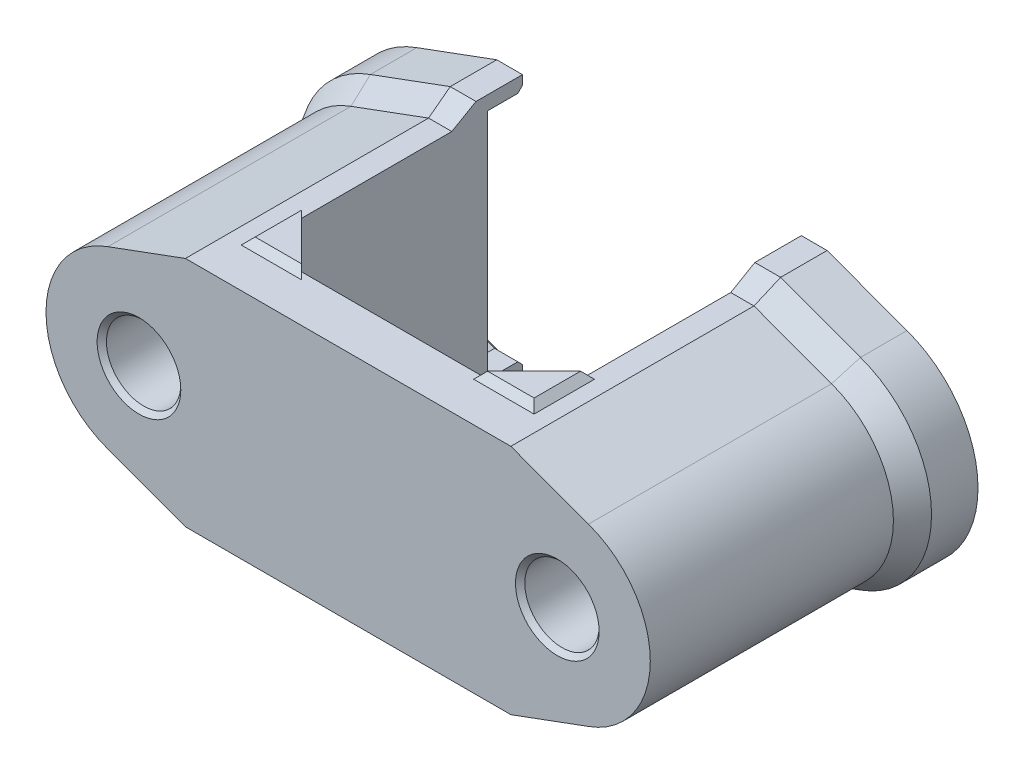
from build123d import *
from OCP.BRepFilletAPI import BRepFilletAPI_MakeChamfer

# Parameters (mm, degrees)
SKIZZE2_R                            = 1.6
AUFSATZ_LINEAR_AUSTRAGEN1_DEPTH      = 12
SCHNITT_LINEAR_AUSTRAGEN1_DEPTH      = 19.384776311
SCHNITT_LINEAR_AUSTRAGEN1_DEPTH_BACK = 19.384776311
SKIZZE3_W                            = 12
SKIZZE3_H                            = 10
AUFSATZ_LINEAR_AUSTRAGEN2_DEPTH      = 12
AUFSATZ_LINEAR_START                 = -0.4
AUFSATZ_LINEAR_AUSTRAGEN3_DEPTH      = 0.7
FASE3_SIZE                           = 0.3
AUFSATZ_LINEAR_AUSTRAGEN4_DEPTH      = 2
FASE1_SIZE                           = 0.6
FASE1_SIZE_2                         = 1.039230485
FASE2_SIZE                           = 0.2


with BuildPart() as part:
    # Skizze2 → Aufsatz-Linear austragen1 (new body)
    with BuildSketch(Plane.XY):
        with BuildLine():
            Line((-6, -2.645751311), (-6, -5))
            Line((-6, -5), (6, -5))
            Line((6, -5), (6, -2.645751311))
            ThreePointArc((6, -2.645751311), (13, 0), (6, 2.645751311))
            Line((6, 2.645751311), (6, 5))
            Line((6, 5), (-6, 5))
            Line((-6, 5), (-6, 2.645751311))
            ThreePointArc((-6, 2.645751311), (-13, 0), (-6, -2.645751311))
        make_face()
        with Locations((-9, 0)):
            Circle(SKIZZE2_R, mode=Mode.SUBTRACT)
        with Locations(Location((9, 0, 0), (0, 0, 180))):
            Circle(SKIZZE2_R, mode=Mode.SUBTRACT)
    extrude(amount=AUFSATZ_LINEAR_AUSTRAGEN1_DEPTH)

    # Skizze3 → Schnitt-Linear austragen1 (cut, two sides: drawn at the far end of the back side and taken through both)
    with BuildSketch(Plane(origin=(0, 0, 0), x_dir=(-1, 0, 0), z_dir=(0, -1, 0)).offset(-SCHNITT_LINEAR_AUSTRAGEN1_DEPTH_BACK)):
        with Locations((0, -5)):
            Rectangle(SKIZZE3_W, SKIZZE3_H)
    extrude(amount=SCHNITT_LINEAR_AUSTRAGEN1_DEPTH + SCHNITT_LINEAR_AUSTRAGEN1_DEPTH_BACK, mode=Mode.SUBTRACT)

    # Skizze4 → Aufsatz-Linear austragen2 (add, through all)
    with BuildSketch(Plane.XY.offset(12)):
        with BuildLine():
            Line((-6, 2.645751311), (-6, 5))
            Line((-6, 5), (-7, 5))
            Line((-7, 5), (-10.338485005, 3.769410815))
            ThreePointArc((-10.338485005, 3.769410815), (-7.997098863, 3.872233117), (-6, 2.645751311))
        make_face()
        with BuildLine():
            ThreePointArc((-6, -2.645751311), (-7.997098863, -3.872233117), (-10.338485005, -3.769410815))
            Line((-10.338485005, -3.769410815), (-7, -5))
            Line((-7, -5), (-6, -5))
            Line((-6, -5), (-6, -2.645751311))
        make_face()
        with BuildLine():
            ThreePointArc((6, 2.645751311), (7.997098863, 3.872233117), (10.338485005, 3.769410815))
            Line((10.338485005, 3.769410815), (7, 5))
            Line((7, 5), (6, 5))
            Line((6, 5), (6, 2.645751311))
        make_face()
        with BuildLine():
            Line((6, -2.645751311), (6, -5))
            Line((6, -5), (7, -5))
            Line((7, -5), (10.338485005, -3.769410815))
            ThreePointArc((10.338485005, -3.769410815), (7.997098863, -3.872233117), (6, -2.645751311))
        make_face()
    extrude(amount=-AUFSATZ_LINEAR_AUSTRAGEN2_DEPTH)

    # Skizze5 → Aufsatz-Linear austragen3 (add)
    with BuildSketch(Plane.XZ.offset(5).offset(AUFSATZ_LINEAR_START)):
        Polygon((-6, 10), (-4, 10), (-6, 8), align=None)
        Polygon((6, 8), (6, 10), (4, 10), align=None)
    aufsatz_linear_austragen3 = extrude(amount=AUFSATZ_LINEAR_AUSTRAGEN3_DEPTH)

    # Spiegeln1: Aufsatz-Linear austragen3 across plane
    add(aufsatz_linear_austragen3.mirror(Plane(origin=(0, 0, 0), x_dir=(0, 0, 1), z_dir=(0, -1, 0))))

    # Fase3
    fase3_edges = [part.edges().sort_by_distance(p)[0] for p in [
        (6, -5, 9),
        (5, -5, 10),
        (-6, -5, 9),
        (-5, -5, 10),
        (6, 5, 9),
        (5, 5, 10),
        (-5, 5, 10),
        (-6, 5, 9),
    ]]
    chamfer(fase3_edges, length=FASE3_SIZE - 0.0001)  # a hair under: the kernel refuses the full size

    # Skizze6 → Aufsatz-Linear austragen4 (add)
    with BuildSketch(Plane(origin=(0, 0, -1.5), x_dir=(-1, 0, 0), z_dir=(0, 0, -1))):
        with BuildLine():
            Line((6, -5), (7, -5))
            Line((7, -5), (10.338485005, -3.769410815))
            ThreePointArc((10.338485005, -3.769410815), (13, 0), (10.338485005, 3.769410815))
            Line((10.338485005, 3.769410815), (7, 5))
            Line((7, 5), (6, 5))
            Line((6, 5), (6, 5.6))
            Line((6, 5.6), (7.107061274, 5.6))
            Line((7.107061274, 5.6), (10.542753877, 4.333579407))
            ThreePointArc((10.542753877, 4.333579407), (13.6, 0), (10.542753877, -4.333579407))
            Line((10.542753877, -4.333579407), (7.107061274, -5.6))
            Line((7.107061274, -5.6), (6, -5.6))
            Line((6, -5.6), (6, -5))
        make_face()
        with BuildLine():
            Line((-6, -5), (-6, -5.6))
            Line((-6, -5.6), (-7.107061274, -5.6))
            Line((-7.107061274, -5.6), (-10.542753877, -4.333579407))
            ThreePointArc((-10.542753877, -4.333579407), (-13.6, 0), (-10.542753877, 4.333579407))
            Line((-10.542753877, 4.333579407), (-7.107061274, 5.6))
            Line((-7.107061274, 5.6), (-6, 5.6))
            Line((-6, 5.6), (-6, 5))
            Line((-6, 5), (-7, 5))
            Line((-7, 5), (-10.338485005, 3.769410815))
            ThreePointArc((-10.338485005, 3.769410815), (-13, 0), (-10.338485005, -3.769410815))
            Line((-10.338485005, -3.769410815), (-7, -5))
            Line((-7, -5), (-6, -5))
        make_face()
    extrude(amount=-AUFSATZ_LINEAR_AUSTRAGEN4_DEPTH)

    # Fase1
    fase1_edges_1 = [part.edges().sort_by_distance(p)[0] for p in [
        (-6.5, -5, 0.5),
    ]]
    fase1_side_1 = [part.faces().sort_by_distance(p)[0] for p in [
        (-6.5, -5.012, 0.5),
    ]]
    fase1_edges_2 = [part.edges().sort_by_distance(p)[0] for p in [
        (-8.669242502, -4.384705408, 0.5),
    ]]
    fase1_side_2 = [part.faces().sort_by_distance(p)[0] for p in [
        (-8.673392811, -4.395964845, 0.5),
    ]]
    fase1_edges_3 = [part.edges().sort_by_distance(p)[0] for p in [
        (-8.669242502, 4.384705408, 0.5),
    ]]
    fase1_side_3 = [part.faces().sort_by_distance(p)[0] for p in [
        (-8.673392811, 4.395964845, 0.5),
    ]]
    fase1_edges_4 = [part.edges().sort_by_distance(p)[0] for p in [
        (-6.5, 5, 0.5),
    ]]
    fase1_side_4 = [part.faces().sort_by_distance(p)[0] for p in [
        (-6.5, 5, 0.512),
    ]]
    fase1_edges_5 = [part.edges().sort_by_distance(p)[0] for p in [
        (6.5, 5, 0.5),
    ]]
    fase1_side_5 = [part.faces().sort_by_distance(p)[0] for p in [
        (6.5, 5, 0.512),
    ]]
    fase1_edges_6 = [part.edges().sort_by_distance(p)[0] for p in [
        (8.669242502, 4.384705408, 0.5),
    ]]
    fase1_side_6 = [part.faces().sort_by_distance(p)[0] for p in [
        (8.669242502, 4.384705408, 0.512),
    ]]
    fase1_edges_7 = [part.edges().sort_by_distance(p)[0] for p in [
        (8.669242502, -4.384705408, 0.5),
    ]]
    fase1_side_7 = [part.faces().sort_by_distance(p)[0] for p in [
        (8.673392811, -4.395964845, 0.5),
    ]]
    fase1_edges_8 = [part.edges().sort_by_distance(p)[0] for p in [
        (6.5, -5, 0.5),
    ]]
    fase1_side_8 = [part.faces().sort_by_distance(p)[0] for p in [
        (6.5, -5.012, 0.5),
    ]]
    fase1 = BRepFilletAPI_MakeChamfer(part.part.solid().wrapped)
    for e in fase1_edges_1:
        fase1.Add(FASE1_SIZE - 0.0001, FASE1_SIZE_2 - 0.0001, e.wrapped, fase1_side_1[0].wrapped)
    for e in fase1_edges_2:
        fase1.Add(FASE1_SIZE - 0.0001, FASE1_SIZE_2 - 0.0001, e.wrapped, fase1_side_2[0].wrapped)
    for e in fase1_edges_3:
        fase1.Add(FASE1_SIZE - 0.0001, FASE1_SIZE_2 - 0.0001, e.wrapped, fase1_side_3[0].wrapped)
    for e in fase1_edges_4:
        fase1.Add(FASE1_SIZE_2 - 0.0001, FASE1_SIZE - 0.0001, e.wrapped, fase1_side_4[0].wrapped)
    for e in fase1_edges_5:
        fase1.Add(FASE1_SIZE_2 - 0.0001, FASE1_SIZE - 0.0001, e.wrapped, fase1_side_5[0].wrapped)
    for e in fase1_edges_6:
        fase1.Add(FASE1_SIZE_2 - 0.0001, FASE1_SIZE - 0.0001, e.wrapped, fase1_side_6[0].wrapped)
    for e in fase1_edges_7:
        fase1.Add(FASE1_SIZE - 0.0001, FASE1_SIZE_2 - 0.0001, e.wrapped, fase1_side_7[0].wrapped)
    for e in fase1_edges_8:
        fase1.Add(FASE1_SIZE - 0.0001, FASE1_SIZE_2 - 0.0001, e.wrapped, fase1_side_8[0].wrapped)
    add(Compound.cast(fase1.Shape()), mode=Mode.REPLACE)  # a hair under: the kernel refuses the full size

    # Fase2
    fase2_edges = [part.edges().sort_by_distance(p)[0] for p in [
        (-6.5, -5, -1.5),
        (-8.669242502, -4.384705408, -1.5),
        (-8.669242502, 4.384705408, -1.5),
        (-6.5, 5, -1.5),
        (6.5, -5, -1.5),
        (8.669242502, -4.384705408, -1.5),
        (13, 0, -1.5),
        (8.669242502, 4.384705408, -1.5),
        (6.5, 5, -1.5),
        (-10.6, 0, 12),
        (-10.6, 0, 0),
        (10.6, 0, 12),
        (10.6, 0, 0),
    ]]
    chamfer(fase2_edges, length=FASE2_SIZE)


solid = part.part
